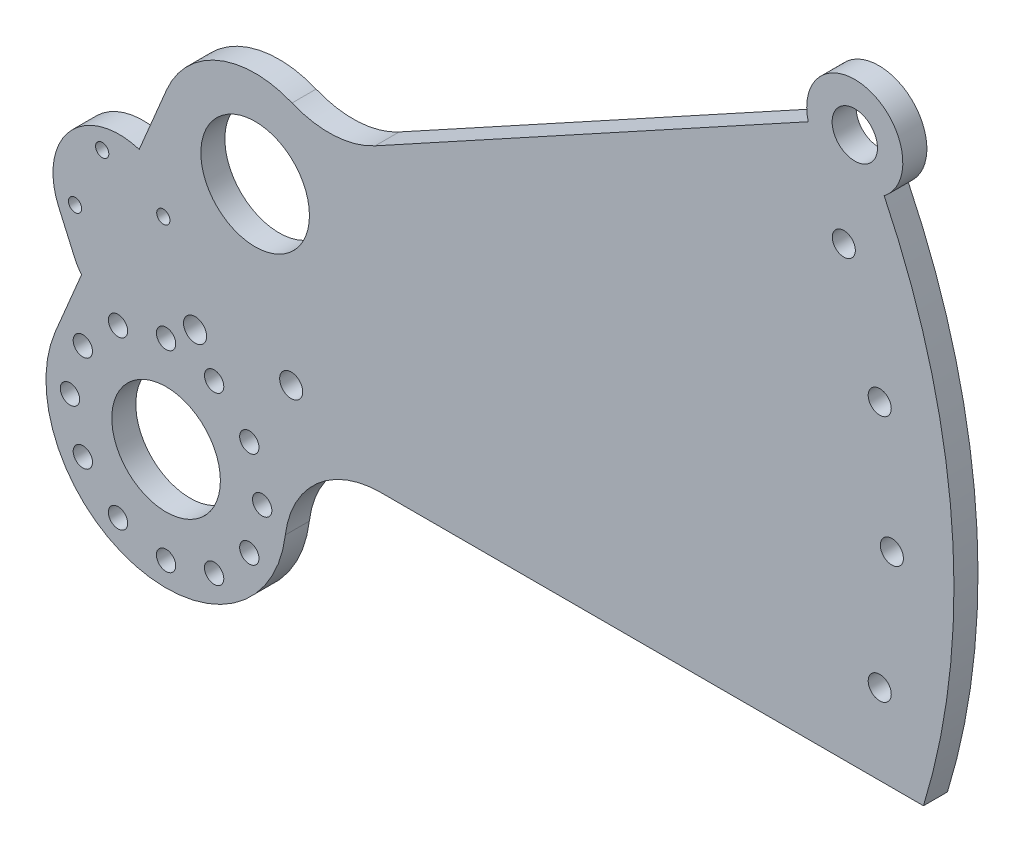
from build123d import *

# Parameters (mm, degrees)
SKETCH1_R           = 1.75
SKETCH1_R_2         = 1.749999999
SKETCH1_R_3         = 3.048
SKETCH1_R_4         = 2.5527
SKETCH1_R_5         = 14.351
SKETCH1_R_6         = 1.749999998
SKETCH1_R_7         = 5.994399998
BOSS_EXTRUDE1_DEPTH = 6.35


with BuildPart() as part:
    # Sketch1 → Boss-Extrude1 (new body)
    with BuildSketch(Plane(origin=(0, 0, 0), x_dir=(-1, 0, 0), z_dir=(0, 0, -1))):
        with BuildLine():
            Line((-31.721738276, 24.629886736), (-146.170088382, 87.365400413))
            ThreePointArc((-146.170088382, 87.365400413), (-162.606044591, 102.518063532), (-166.242121915, 80.46080174))
            ThreePointArc((-166.242121915, 80.46080174), (-184.14138067, 14.224473288), (-176.626960259, -53.975))
            Line((-176.626960259, -53.975), (-33.194381933, -53.975))
            ThreePointArc((-33.194381933, -53.975), (-16.353189449, -60.360946363), (-7.980260893, -76.307737345))
            ThreePointArc((-7.980260893, -76.307737345), (31.676825476, -103.162616272), (52.812443228, -60.184078794))
            Line((52.812443228, -60.184078794), (45.859161932, -43.620642668))
            ThreePointArc((45.859161932, -43.620642668), (46.821980787, -42.387435085), (47.569931868, -41.013247953))
            Line((47.569931868, -41.013247953), (51.934565949, -31.139666326))
            ThreePointArc((51.934565949, -31.139666326), (48.962006063, -12.385946653), (30.645740356, -7.380696976))
            Line((30.645740356, -7.380696976), (23.420042257, 9.831664187))
            ThreePointArc((23.420042257, 9.831664187), (9.646239087, 23.497022609), (-9.756276384, 23.451547307))
            ThreePointArc((-9.756276384, 23.451547307), (-20.87318194, 21.539563941), (-31.721738276, 24.629886736))
        make_face()
        with Locations((40.421189912, -12.399445261)):
            Circle(SKETCH1_R, mode=Mode.SUBTRACT)
        with Locations((47.593474649, -28.556744898)):
            Circle(SKETCH1_R_2, mode=Mode.SUBTRACT)
        with Locations((15.875, -41.275)):
            Circle(SKETCH1_R_3, mode=Mode.SUBTRACT)
        with Locations((45.534435664, -85.173659028)):
            Circle(SKETCH1_R_4, mode=Mode.SUBTRACT)
        with Locations((48.937390408, -72.473659028)):
            Circle(SKETCH1_R_4, mode=Mode.SUBTRACT)
        with Locations((23.537390406, -72.473659028)):
            Circle(SKETCH1_R_5, mode=Mode.SUBTRACT)
        with Locations((-9.525, -41.275)):
            Circle(SKETCH1_R_3, mode=Mode.SUBTRACT)
        with Locations((-165.068836882, 32.691814205)):
            Circle(SKETCH1_R_3, mode=Mode.SUBTRACT)
        with Locations((-165.068836882, -32.691814205)):
            Circle(SKETCH1_R_3, mode=Mode.SUBTRACT)
        with Locations((-155.572522319, 64.137866544)):
            Circle(SKETCH1_R_3, mode=Mode.SUBTRACT)
        with Locations((-168.275000002, 0)):
            Circle(SKETCH1_R_3, mode=Mode.SUBTRACT)
        Circle(SKETCH1_R_5, mode=Mode.SUBTRACT)
        with Locations((24.263890274, -19.571729998)):
            Circle(SKETCH1_R_6, mode=Mode.SUBTRACT)
        with Locations((-158.474943348, 90.508733721)):
            Circle(SKETCH1_R_7, mode=Mode.SUBTRACT)
        with Locations((36.237390407, -94.470704285)):
            Circle(SKETCH1_R_4, mode=Mode.SUBTRACT)
        with Locations((23.537390406, -97.873659029)):
            Circle(SKETCH1_R_4, mode=Mode.SUBTRACT)
        with Locations((10.837390405, -94.470704285)):
            Circle(SKETCH1_R_4, mode=Mode.SUBTRACT)
        with Locations((1.540345149, -85.173659028)):
            Circle(SKETCH1_R_4, mode=Mode.SUBTRACT)
        with Locations((-1.862609595, -72.473659028)):
            Circle(SKETCH1_R_4, mode=Mode.SUBTRACT)
        with Locations((1.540345149, -59.773659027)):
            Circle(SKETCH1_R_4, mode=Mode.SUBTRACT)
        with Locations((10.837390405, -50.47661377)):
            Circle(SKETCH1_R_4, mode=Mode.SUBTRACT)
        with Locations((23.537390406, -47.073659026)):
            Circle(SKETCH1_R_4, mode=Mode.SUBTRACT)
        with Locations((36.237390407, -50.47661377)):
            Circle(SKETCH1_R_4, mode=Mode.SUBTRACT)
        with Locations((45.534435664, -59.773659027)):
            Circle(SKETCH1_R_4, mode=Mode.SUBTRACT)
    extrude(amount=-BOSS_EXTRUDE1_DEPTH)


solid = part.part
